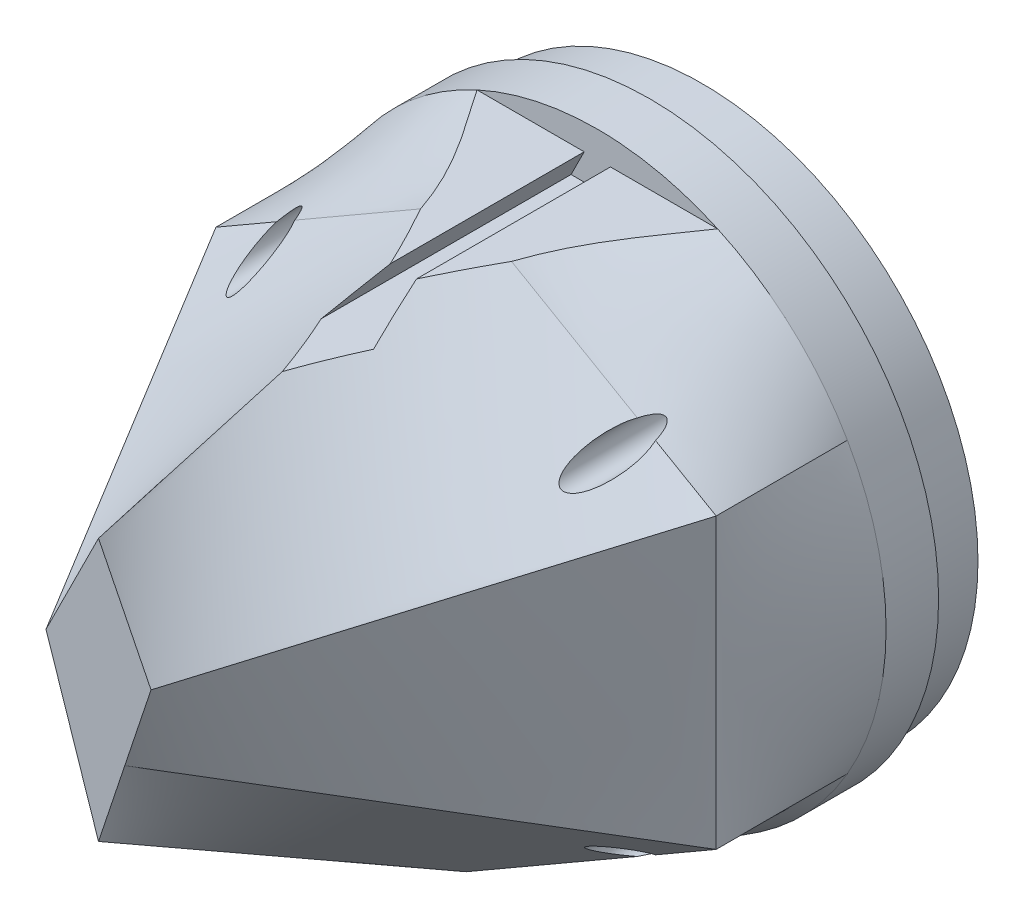
from build123d import *

# Parameters (mm, degrees)
SKETCH_1_R          = 55
EXTRUDE_1_DEPTH     = 10
SKETCH_2_R          = 52.5
SKETCH_2_R_2        = 50
EXTRUDE_2_DEPTH     = 10
CUT_EXTRUDE_1_DEPTH = 35
CUT_EXTRUDE_START   = -95
CUT_EXTRUDE_2_DEPTH = 60
SKETCH_8_R          = 5
CUT_EXTRUDE_3_DEPTH = 146.859521626
CUT_EXTRUDE_START_2 = -5
SKETCH_9_R          = 3
CUT_EXTRUDE_4_DEPTH = 128.780291745
SKETCH_10_R         = 1.5
CUT_EXTRUDE_5_DEPTH = 123.780291745


with BuildPart() as part:
    # 草图1 → 凸台-拉伸1 (new body)
    with BuildSketch(Plane.XY):
        Circle(SKETCH_1_R)
    extrude(amount=EXTRUDE_1_DEPTH)

    # 草图2 → 凸台-拉伸2 (add)
    with BuildSketch(Plane(origin=(0, 0, 0), x_dir=(-1, 0, 0), z_dir=(0, 0, -1))):
        with Locations(Location((0, 0, 0), (0, 0, 180))):
            Circle(SKETCH_2_R)
        Circle(SKETCH_2_R_2, mode=Mode.SUBTRACT)
    extrude(amount=EXTRUDE_2_DEPTH)

    # 放样1: read off the stored shape, not the designer's step
    # 放样1: loft between two sections, ruled curve by curve
    loft_1_from = [
        Edge.make_bspline([(-47.631397208, 27.5, 35), (-45.646755658, 28.645833333, 35), (-43.662114107, 29.791666667, 35), (-39.692831007, 32.083333333, 35), (-37.708189456, 33.229166667, 35), (-33.738906356, 35.520833333, 35), (-31.754264805, 36.666666667, 35), (-27.784981705, 38.958333333, 35), (-25.800340154, 40.104166667, 35), (-21.831057054, 42.395833333, 35), (-19.846415503, 43.541666667, 35), (-15.877132403, 45.833333333, 35), (-13.892490852, 46.979166667, 35), (-9.923207752, 49.270833333, 35), (-7.938566201, 50.416666667, 35), (-3.969283101, 52.708333333, 35), (-1.98464155, 53.854166667, 35), (0, 55, 35)], [0, 0, 0, 0, 0.125, 0.125, 0.25, 0.25, 0.375, 0.375, 0.5, 0.5, 0.625, 0.625, 0.75, 0.75, 0.875, 0.875, 1, 1, 1, 1], 3),
        Edge.make_bspline([(0, 55, 35), (1.98464155, 53.854166667, 35), (3.969283101, 52.708333333, 35), (7.938566201, 50.416666667, 35), (9.923207752, 49.270833333, 35), (13.892490852, 46.979166667, 35), (15.877132403, 45.833333333, 35), (19.846415503, 43.541666667, 35), (21.831057054, 42.395833333, 35), (25.800340154, 40.104166667, 35), (27.784981705, 38.958333333, 35), (31.754264805, 36.666666667, 35), (33.738906356, 35.520833333, 35), (37.708189456, 33.229166667, 35), (39.692831007, 32.083333333, 35), (43.662114107, 29.791666667, 35), (45.646755658, 28.645833333, 35), (47.631397208, 27.5, 35)], [0, 0, 0, 0, 0.125, 0.125, 0.25, 0.25, 0.375, 0.375, 0.5, 0.5, 0.625, 0.625, 0.75, 0.75, 0.875, 0.875, 1, 1, 1, 1], 3),
        Edge.make_bspline([(-47.631397208, -27.5, 35), (-47.631397208, -25.208333333, 35), (-47.631397208, -22.916666667, 35), (-47.631397208, -18.333333333, 35), (-47.631397208, -16.041666667, 35), (-47.631397208, -11.458333333, 35), (-47.631397208, -9.166666667, 35), (-47.631397208, -4.583333333, 35), (-47.631397208, -2.291666667, 35), (-47.631397208, 2.291666667, 35), (-47.631397208, 4.583333333, 35), (-47.631397208, 9.166666667, 35), (-47.631397208, 11.458333333, 35), (-47.631397208, 16.041666667, 35), (-47.631397208, 18.333333333, 35), (-47.631397208, 22.916666667, 35), (-47.631397208, 25.208333333, 35), (-47.631397208, 27.5, 35)], [0, 0, 0, 0, 0.125, 0.125, 0.25, 0.25, 0.375, 0.375, 0.5, 0.5, 0.625, 0.625, 0.75, 0.75, 0.875, 0.875, 1, 1, 1, 1], 3),
        Edge.make_bspline([(47.631397208, 27.5, 35), (47.631397208, 25.208333333, 35), (47.631397208, 22.916666667, 35), (47.631397208, 18.333333333, 35), (47.631397208, 16.041666667, 35), (47.631397208, 11.458333333, 35), (47.631397208, 9.166666667, 35), (47.631397208, 4.583333333, 35), (47.631397208, 2.291666667, 35), (47.631397208, -2.291666667, 35), (47.631397208, -4.583333333, 35), (47.631397208, -9.166666667, 35), (47.631397208, -11.458333333, 35), (47.631397208, -16.041666667, 35), (47.631397208, -18.333333333, 35), (47.631397208, -22.916666667, 35), (47.631397208, -25.208333333, 35), (47.631397208, -27.5, 35)], [0, 0, 0, 0, 0.125, 0.125, 0.25, 0.25, 0.375, 0.375, 0.5, 0.5, 0.625, 0.625, 0.75, 0.75, 0.875, 0.875, 1, 1, 1, 1], 3),
        Edge.make_bspline([(47.631397208, -27.5, 35), (45.646755658, -28.645833333, 35), (43.662114107, -29.791666667, 35), (39.692831007, -32.083333333, 35), (37.708189456, -33.229166667, 35), (33.738906356, -35.520833333, 35), (31.754264805, -36.666666667, 35), (27.784981705, -38.958333333, 35), (25.800340154, -40.104166667, 35), (21.831057054, -42.395833333, 35), (19.846415503, -43.541666667, 35), (15.877132403, -45.833333333, 35), (13.892490852, -46.979166667, 35), (9.923207752, -49.270833333, 35), (7.938566201, -50.416666667, 35), (3.969283101, -52.708333333, 35), (1.98464155, -53.854166667, 35), (0, -55, 35)], [0, 0, 0, 0, 0.125, 0.125, 0.25, 0.25, 0.375, 0.375, 0.5, 0.5, 0.625, 0.625, 0.75, 0.75, 0.875, 0.875, 1, 1, 1, 1], 3),
        Edge.make_bspline([(0, -55, 35), (-1.98464155, -53.854166667, 35), (-3.969283101, -52.708333333, 35), (-7.938566201, -50.416666667, 35), (-9.923207752, -49.270833333, 35), (-13.892490852, -46.979166667, 35), (-15.877132403, -45.833333333, 35), (-19.846415503, -43.541666667, 35), (-21.831057054, -42.395833333, 35), (-25.800340154, -40.104166667, 35), (-27.784981705, -38.958333333, 35), (-31.754264805, -36.666666667, 35), (-33.738906356, -35.520833333, 35), (-37.708189456, -33.229166667, 35), (-39.692831007, -32.083333333, 35), (-43.662114107, -29.791666667, 35), (-45.646755658, -28.645833333, 35), (-47.631397208, -27.5, 35)], [0, 0, 0, 0, 0.125, 0.125, 0.25, 0.25, 0.375, 0.375, 0.5, 0.5, 0.625, 0.625, 0.75, 0.75, 0.875, 0.875, 1, 1, 1, 1], 3),
    ]
    loft_1_to = [
        Edge.make_bspline([(-47.631397208, 27.5, 10), (-46.485563875, 29.48464155, 10), (-45.195867625, 31.430990938, 10), (-42.336258371, 35.188277436, 10), (-40.766321149, 36.999041951, 10), (-37.369585673, 40.426923108, 10), (-35.542833502, 42.043859586, 10), (-31.671548549, 45.032123587, 10), (-29.627132403, 46.403296743, 10), (-25.372867597, 48.859497673, 10), (-23.163188738, 49.944427414, 10), (-18.639633724, 51.802926528, 10), (-16.325949572, 52.576472075, 10), (-11.65894967, 53.804190709, 10), (-9.30581299, 54.258413968, 10), (-4.622102806, 54.856264978, 10), (-2.291666667, 55, 10), (0, 55, 10)], [0, 0, 0, 0, 0.125, 0.125, 0.25, 0.25, 0.375, 0.375, 0.5, 0.5, 0.625, 0.625, 0.75, 0.75, 0.875, 0.875, 1, 1, 1, 1], 3),
        Edge.make_bspline([(0, 55, 10), (2.291666667, 55, 10), (4.622102806, 54.856264978, 10), (9.30581299, 54.258413968, 10), (11.65894967, 53.804190709, 10), (16.325949572, 52.576472075, 10), (18.639633724, 51.802926528, 10), (23.163188738, 49.944427414, 10), (25.372867597, 48.859497673, 10), (29.627132403, 46.403296743, 10), (31.671548549, 45.032123587, 10), (35.542833502, 42.043859586, 10), (37.369585673, 40.426923108, 10), (40.766321149, 36.999041951, 10), (42.336258371, 35.188277436, 10), (45.195867625, 31.430990938, 10), (46.485563875, 29.48464155, 10), (47.631397208, 27.5, 10)], [0, 0, 0, 0, 0.125, 0.125, 0.25, 0.25, 0.375, 0.375, 0.5, 0.5, 0.625, 0.625, 0.75, 0.75, 0.875, 0.875, 1, 1, 1, 1], 3),
        Edge.make_bspline([(-47.631397208, -27.5, 10), (-48.777230541, -25.51535845, 10), (-49.817970431, -23.42527404, 10), (-51.64207136, -19.070136532, 10), (-52.425270819, -16.805148759, 10), (-53.695535244, -12.149548968, 10), (-54.182467226, -9.759066942, 10), (-54.834737287, -4.912303828, 10), (-55, -2.456200931, 10), (-55, 2.456200931, 10), (-54.834737287, 4.912303828, 10), (-54.182467226, 9.759066942, 10), (-53.695535244, 12.149548968, 10), (-52.425270819, 16.805148759, 10), (-51.64207136, 19.070136532, 10), (-49.817970431, 23.42527404, 10), (-48.777230541, 25.51535845, 10), (-47.631397208, 27.5, 10)], [0, 0, 0, 0, 0.125, 0.125, 0.25, 0.25, 0.375, 0.375, 0.5, 0.5, 0.625, 0.625, 0.75, 0.75, 0.875, 0.875, 1, 1, 1, 1], 3),
        Edge.make_bspline([(47.631397208, 27.5, 10), (48.777230541, 25.51535845, 10), (49.817970431, 23.42527404, 10), (51.64207136, 19.070136532, 10), (52.425270819, 16.805148759, 10), (53.695535244, 12.149548968, 10), (54.182467226, 9.759066942, 10), (54.834737287, 4.912303828, 10), (55, 2.456200931, 10), (55, -2.456200931, 10), (54.834737287, -4.912303828, 10), (54.182467226, -9.759066942, 10), (53.695535244, -12.149548968, 10), (52.425270819, -16.805148759, 10), (51.64207136, -19.070136532, 10), (49.817970431, -23.42527404, 10), (48.777230541, -25.51535845, 10), (47.631397208, -27.5, 10)], [0, 0, 0, 0, 0.125, 0.125, 0.25, 0.25, 0.375, 0.375, 0.5, 0.5, 0.625, 0.625, 0.75, 0.75, 0.875, 0.875, 1, 1, 1, 1], 3),
        Edge.make_bspline([(47.631397208, -27.5, 10), (46.485563875, -29.48464155, 10), (45.195867625, -31.430990938, 10), (42.336258371, -35.188277436, 10), (40.766321149, -36.999041951, 10), (37.369585673, -40.426923108, 10), (35.542833502, -42.043859586, 10), (31.671548549, -45.032123587, 10), (29.627132403, -46.403296743, 10), (25.372867597, -48.859497673, 10), (23.163188738, -49.944427414, 10), (18.639633724, -51.802926528, 10), (16.325949572, -52.576472075, 10), (11.65894967, -53.804190709, 10), (9.30581299, -54.258413968, 10), (4.622102806, -54.856264978, 10), (2.291666667, -55, 10), (0, -55, 10)], [0, 0, 0, 0, 0.125, 0.125, 0.25, 0.25, 0.375, 0.375, 0.5, 0.5, 0.625, 0.625, 0.75, 0.75, 0.875, 0.875, 1, 1, 1, 1], 3),
        Edge.make_bspline([(0, -55, 10), (-2.291666667, -55, 10), (-4.622102806, -54.856264978, 10), (-9.30581299, -54.258413968, 10), (-11.65894967, -53.804190709, 10), (-16.325949572, -52.576472075, 10), (-18.639633724, -51.802926528, 10), (-23.163188738, -49.944427414, 10), (-25.372867597, -48.859497673, 10), (-29.627132403, -46.403296743, 10), (-31.671548549, -45.032123587, 10), (-35.542833502, -42.043859586, 10), (-37.369585673, -40.426923108, 10), (-40.766321149, -36.999041951, 10), (-42.336258371, -35.188277436, 10), (-45.195867625, -31.430990938, 10), (-46.485563875, -29.48464155, 10), (-47.631397208, -27.5, 10)], [0, 0, 0, 0, 0.125, 0.125, 0.25, 0.25, 0.375, 0.375, 0.5, 0.5, 0.625, 0.625, 0.75, 0.75, 0.875, 0.875, 1, 1, 1, 1], 3),
    ]
    loft_1 = Solid(Shell([*[Face.make_surface_from_curves(loft_1_from[k], loft_1_to[k]) for k in range(6)], Face(Wire(loft_1_from)), Face(Wire(loft_1_to))]))
    add(loft_1)

    # 放样2: read off the stored shape, not the designer's step
    # 放样2: loft between two sections, ruled curve by curve
    loft_2_from = [
        Edge.make_bspline([(-47.631397208, 27.5, 35), (-47.631397208, 18.333333333, 35), (-47.631397208, 9.166666667, 35), (-47.631397208, -9.166666667, 35), (-47.631397208, -18.333333333, 35), (-47.631397208, -27.5, 35)], [0, 0, 0, 0, 0.5, 0.5, 1, 1, 1, 1], 3),
        Edge.make_bspline([(-47.631397208, -27.5, 35), (-39.692831007, -32.083333333, 35), (-31.754264805, -36.666666667, 35), (-15.877132403, -45.833333333, 35), (-7.938566201, -50.416666667, 35), (0, -55, 35)], [0, 0, 0, 0, 0.5, 0.5, 1, 1, 1, 1], 3),
        Edge.make_bspline([(0, 55, 35), (-7.938566201, 50.416666667, 35), (-15.877132403, 45.833333333, 35), (-31.754264805, 36.666666667, 35), (-39.692831007, 32.083333333, 35), (-47.631397208, 27.5, 35)], [0, 0, 0, 0, 0.5, 0.5, 1, 1, 1, 1], 3),
        Edge.make_bspline([(0, -55, 35), (7.938566201, -50.416666667, 35), (15.877132403, -45.833333333, 35), (31.754264805, -36.666666667, 35), (39.692831007, -32.083333333, 35), (47.631397208, -27.5, 35)], [0, 0, 0, 0, 0.5, 0.5, 1, 1, 1, 1], 3),
        Edge.make_bspline([(47.631397208, -27.5, 35), (47.631397208, -18.333333333, 35), (47.631397208, -9.166666667, 35), (47.631397208, 9.166666667, 35), (47.631397208, 18.333333333, 35), (47.631397208, 27.5, 35)], [0, 0, 0, 0, 0.5, 0.5, 1, 1, 1, 1], 3),
        Edge.make_bspline([(47.631397208, 27.5, 35), (39.692831007, 32.083333333, 35), (31.754264805, 36.666666667, 35), (15.877132403, 45.833333333, 35), (7.938566201, 50.416666667, 35), (0, 55, 35)], [0, 0, 0, 0, 0.5, 0.5, 1, 1, 1, 1], 3),
    ]
    loft_2_to = [
        Edge.make_bspline([(-10, 15, 105), (-9.166666667, 12.5, 105), (-8.333333333, 10, 105), (-6.666666667, 5, 105), (-5.833333333, 2.5, 105), (-5, 0, 105)], [0, 0, 0, 0, 0.5, 0.5, 1, 1, 1, 1], 3),
        Edge.make_bspline([(-5, 0, 105), (-4.166666667, -2.5, 105), (-3.333333333, -5, 105), (-1.666666667, -10, 105), (-0.833333333, -12.5, 105), (0, -15, 105)], [0, 0, 0, 0, 0.5, 0.5, 1, 1, 1, 1], 3),
        Edge.make_bspline([(0, 35, 105), (-1.666666667, 31.666666667, 105), (-3.333333333, 28.333333333, 105), (-6.666666667, 21.666666667, 105), (-8.333333333, 18.333333333, 105), (-10, 15, 105)], [0, 0, 0, 0, 0.5, 0.5, 1, 1, 1, 1], 3),
        Edge.make_bspline([(0, -15, 105), (0.833333333, -12.5, 105), (1.666666667, -10, 105), (3.333333333, -5, 105), (4.166666667, -2.5, 105), (5, 0, 105)], [0, 0, 0, 0, 0.5, 0.5, 1, 1, 1, 1], 3),
        Edge.make_bspline([(5, 0, 105), (5.833333333, 2.5, 105), (6.666666667, 5, 105), (8.333333333, 10, 105), (9.166666667, 12.5, 105), (10, 15, 105)], [0, 0, 0, 0, 0.5, 0.5, 1, 1, 1, 1], 3),
        Edge.make_bspline([(10, 15, 105), (8.333333333, 18.333333333, 105), (6.666666667, 21.666666667, 105), (3.333333333, 28.333333333, 105), (1.666666667, 31.666666667, 105), (0, 35, 105)], [0, 0, 0, 0, 0.5, 0.5, 1, 1, 1, 1], 3),
    ]
    loft_2 = Solid(Shell([*[Face.make_surface_from_curves(loft_2_from[k], loft_2_to[k]) for k in range(6)], Face(Wire(loft_2_from)), Face(Wire(loft_2_to))]))
    add(loft_2)

    # 草图6 → 切除-拉伸1 (cut)
    with BuildSketch(Plane(origin=(0, 0, 0), x_dir=(-1, 0, 0), z_dir=(0, 0, -1))):
        with BuildLine():
            Line((-26.457513111, -30), (26.457513111, -30))
            ThreePointArc((26.457513111, -30), (0, 40), (-26.457513111, -30))
        make_face()
    extrude(amount=-CUT_EXTRUDE_1_DEPTH, mode=Mode.SUBTRACT)

    # 草图7 → 切除-拉伸2 (cut)
    with BuildSketch(Plane.XY.offset(105).offset(CUT_EXTRUDE_START)):
        Polygon((-50, 60), (50, 60), (50, 50), (2.5, 50), (5, 45), (-5, 45), (-2.5, 50), (-50, 50), align=None)
    extrude(amount=CUT_EXTRUDE_2_DEPTH, mode=Mode.SUBTRACT)

    # 草图8 → 切除-拉伸3 (cut, through all)
    with BuildSketch(Plane(origin=(0, -30, 0), x_dir=(1, 0, 0), z_dir=(0, 1, 0))):
        with Locations(Location((0, -15, 0), (0, 0, 270))):
            Circle(SKETCH_8_R)
    extrude(amount=-CUT_EXTRUDE_3_DEPTH, mode=Mode.SUBTRACT)

    # 草图9 → 切除-拉伸4 (cut, through all)
    with BuildSketch(Plane.XY.offset(10).offset(CUT_EXTRUDE_START_2)):
        with Locations(Location((-33.234018716, 33.234018716, 0), (0, 0, 161.901466082))):
            Circle(SKETCH_9_R)
        with Locations(Location((33.234018716, 33.234018716, 0), (0, 0, 101.901466082))):
            Circle(SKETCH_9_R)
        with Locations(Location((33.234018716, -33.234018716, 0), (0, 0, 258.098533918))):
            Circle(SKETCH_9_R)
        with Locations(Location((-33.234018716, -33.234018716, 0), (0, 0, 198.098533918))):
            Circle(SKETCH_9_R)
    extrude(amount=CUT_EXTRUDE_4_DEPTH, mode=Mode.SUBTRACT)

    # 草图10 → 切除-拉伸5 (cut, through all)
    with BuildSketch(Plane.XY.offset(10)):
        with Locations((-33.234018716, 33.234018716)):
            Circle(SKETCH_10_R)
        with Locations((33.234018716, 33.234018716)):
            Circle(SKETCH_10_R)
        with Locations((33.234018716, -33.234018716)):
            Circle(SKETCH_10_R)
        with Locations((-33.234018716, -33.234018716)):
            Circle(SKETCH_10_R)
    extrude(amount=-CUT_EXTRUDE_5_DEPTH, mode=Mode.SUBTRACT)


solid = part.part
